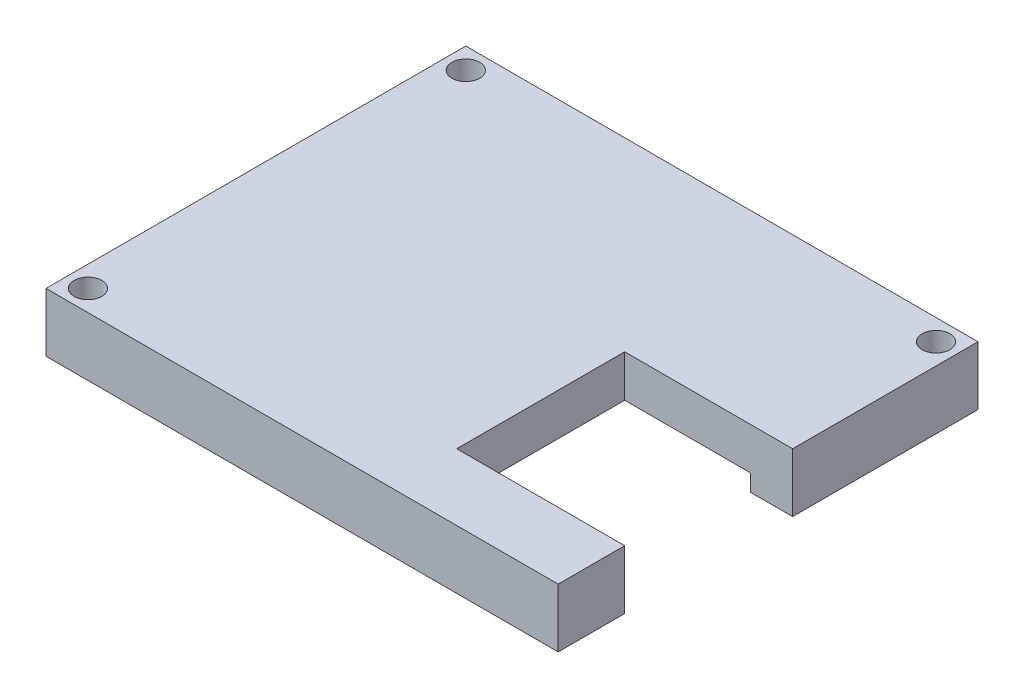
from build123d import *

# Parameters (mm, degrees)
SKETCH1_W           = 77.47
SKETCH1_H           = 63.5
BOSS_EXTRUDE1_DEPTH = 6.35
SKETCH1_3_W         = 77.47
SKETCH1_3_H         = 63.5
SKETCH1_3_W_2       = 64.77
SKETCH1_3_H_2       = 50.8
BOSS_EXTRUDE2_DEPTH = 2.54
SKETCH2_W           = 25.4
SKETCH2_H           = 25.4
CUT_EXTRUDE1_DEPTH  = 12.7
SKETCH3_R           = 2.1
CUT_EXTRUDE2_DEPTH  = 12.7


with BuildPart() as part:
    # Sketch1 → Boss-Extrude1 (new body)
    with BuildSketch(Plane(origin=(0, 0, 0), x_dir=(1, 0, 0), z_dir=(0, 1, 0))):
        with Locations((32.385, 26.545081967)):
            Rectangle(SKETCH1_W, SKETCH1_H)
    extrude(amount=BOSS_EXTRUDE1_DEPTH)

    # Sketch1<3> → Boss-Extrude2 (add)
    with BuildSketch(Plane(origin=(0, 0, 0), x_dir=(1, 0, 0), z_dir=(0, 1, 0))):
        with Locations((32.385, 26.545081967)):
            Rectangle(SKETCH1_3_W, SKETCH1_3_H)
        with Locations((32.385, 25.4)):
            Rectangle(SKETCH1_3_W_2, SKETCH1_3_H_2, mode=Mode.SUBTRACT)
    extrude(amount=-BOSS_EXTRUDE2_DEPTH)

    # Sketch2 → Cut-Extrude1 (cut)
    with BuildSketch(Plane.XZ.offset(2.54)):
        with Locations((58.42, -17.556565957)):
            Rectangle(SKETCH2_W, SKETCH2_H)
    extrude(amount=-CUT_EXTRUDE1_DEPTH, mode=Mode.SUBTRACT)

    # Sketch3 → Cut-Extrude2 (cut)
    with BuildSketch(Plane.XZ.offset(2.54)):
        with Locations((-3.175, 2.029918033)):
            Circle(SKETCH3_R)
        with Locations((-3.175, -55.120081967)):
            Circle(SKETCH3_R)
        with Locations((67.945, -55.120081967)):
            Circle(SKETCH3_R)
    extrude(amount=-CUT_EXTRUDE2_DEPTH, mode=Mode.SUBTRACT)


solid = part.part
